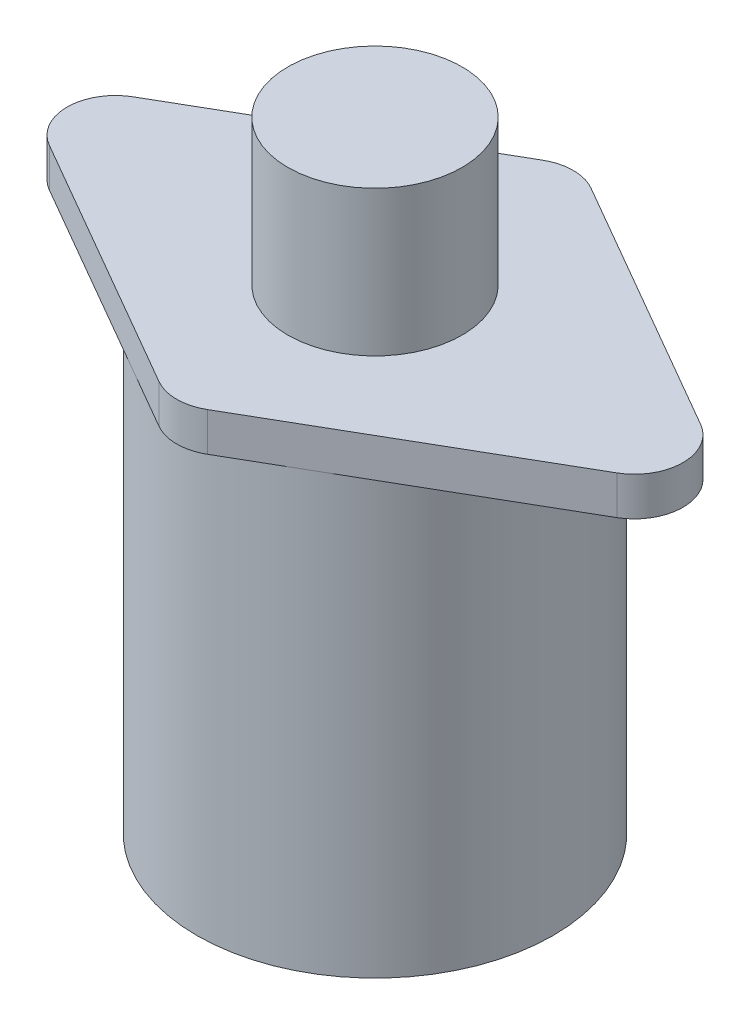
from build123d import *

# Parameters (mm, degrees)
SKETCH1_R           = 18.4
BOSS_EXTRUDE1_DEPTH = 45
BOSS_EXTRUDE2_DEPTH = 4
FILLET1_R           = 5
SKETCH3_R           = 9
BOSS_EXTRUDE3_DEPTH = 15


with BuildPart() as part:
    # Sketch1 → Boss-Extrude1 (new body)
    with BuildSketch(Plane(origin=(0, 0, 0), x_dir=(1, 0, 0), z_dir=(0, 1, 0))):
        Circle(SKETCH1_R)
    extrude(amount=BOSS_EXTRUDE1_DEPTH)

    # Sketch2 → Boss-Extrude2 (add)
    with BuildSketch(Plane(origin=(0, 45, 0), x_dir=(1, 0, 0), z_dir=(0, 1, 0))):
        Polygon((0, 21.25), (-36.806079661, 0), (0, -21.25), (36.806079661, 0), align=None)
    extrude(amount=BOSS_EXTRUDE2_DEPTH)

    # Fillet1
    fillet1_edges = [part.edges().sort_by_distance(p)[0] for p in [
        (0, 47, -21.25),
        (0, 47, 21.25),
        (36.806079661, 47, 0),
        (-36.806079661, 47, 0),
    ]]
    fillet(fillet1_edges, radius=FILLET1_R)

    # Sketch3 → Boss-Extrude3 (add)
    with BuildSketch(Plane(origin=(0, 49, 0), x_dir=(1, 0, 0), z_dir=(0, 1, 0))):
        Circle(SKETCH3_R)
    extrude(amount=BOSS_EXTRUDE3_DEPTH)


solid = part.part
